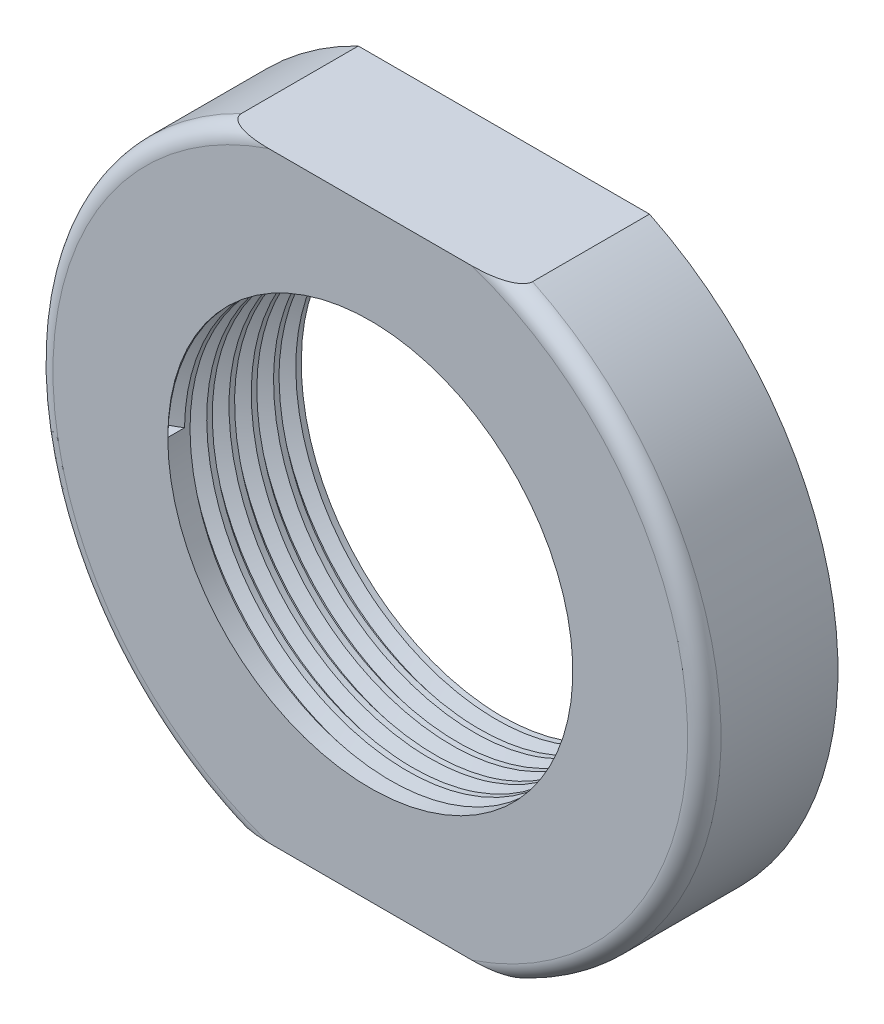
from build123d import *

# Parameters (mm, degrees)
BOSS_EXTRUDE1_DEPTH = 12.7
SKETCH5_R           = 19.2484375
CUT_EXTRUDE1_DEPTH  = 45.563248591
FILLET1_R           = 1.5875
THREAD1_PITCH       = 2.116666667


with BuildPart() as part:
    # Sketch2 → Boss-Extrude1 (new body)
    with BuildSketch(Plane.XY):
        with BuildLine():
            Line((-13.839504146, 28.575), (13.839504146, 28.575))
            ThreePointArc((13.839504146, 28.575), (31.75, 0), (13.839504146, -28.575))
            Line((13.839504146, -28.575), (-13.839504146, -28.575))
            ThreePointArc((-13.839504146, -28.575), (-31.75, 0), (-13.839504146, 28.575))
        make_face()
    extrude(amount=-BOSS_EXTRUDE1_DEPTH)

    # Sketch5 → Cut-Extrude1 (cut, through all)
    with BuildSketch(Plane.XY):
        Circle(SKETCH5_R)
    extrude(amount=-CUT_EXTRUDE1_DEPTH, mode=Mode.SUBTRACT)

    # Fillet1
    fillet1_edges = [part.edges().sort_by_distance(p)[0] for p in [
        (31.75, 0, 0),
        (-31.75, 0, 0),
    ]]
    fillet(fillet1_edges, radius=FILLET1_R)

    # Thread1: the profile of Thread Profile2 profile screwed along a right-hand helix of 18 turns, 10 arcs to a turn; built about Z, then put on its axis
    thread1_z = Axis((0, 0, 0), (0, 0, 1))
    thread1_corners = [(19.2481375, 0, -0.000173205), (20.394116935, 0, 0.66145833), (20.394116935, 0, 0.926041664), (19.2481375, 0, 1.587673199)]
    with BuildLine(mode=Mode.PRIVATE) as thread1_profile:
        Line(thread1_corners[0], thread1_corners[1])
        Line(thread1_corners[1], thread1_corners[2])
        Line(thread1_corners[2], thread1_corners[3])
        Line(thread1_corners[3], thread1_corners[0])
    thread1_cap = Face(thread1_profile.wire())
    thread1_turn_angles = [0, 18, 36, 54, 72, 90, 108, 126, 144, 162, 180, 198, 216, 234, 252, 270, 288, 306, 324, 342, 360]
    thread1_turn_weights = [1, 0.9510565162951535, 1, 0.9510565162951535, 1, 0.9510565162951535, 1, 0.9510565162951535, 1, 0.9510565162951535, 1, 0.9510565162951535, 1, 0.9510565162951535, 1, 0.9510565162951535, 1, 0.9510565162951535, 1, 0.9510565162951535, 1]
    thread1_turn_rails = [Edge.make_bspline([Vector(p[0], p[1], 0).rotate(thread1_z, thread1_turn_angles[k]) / thread1_turn_weights[k] + Vector(0, 0, p[2] + THREAD1_PITCH * thread1_turn_angles[k] / 360) for k in range(21)], [0, 0, 0, 1, 1, 2, 2, 3, 3, 4, 4, 5, 5, 6, 6, 7, 7, 8, 8, 9, 9, 10, 10, 10], 2, thread1_turn_weights) for p in thread1_corners]
    thread1_turn_sides = [Face.make_surface_from_curves(thread1_turn_rails[p[0]], thread1_turn_rails[p[1]]) for p in [(0, 1), (1, 2), (2, 3), (3, 0)]]
    thread1 = Plane(origin=(0, 0, 0), x_dir=(-1, 0, 0), z_dir=(0, 0, -1)) * Solid(Shell([*[p.moved(Location((0, 0, THREAD1_PITCH * i))) for i in range(18) for p in thread1_turn_sides], thread1_cap, thread1_cap.rotate(thread1_z, 6480).moved(Location((0, 0, THREAD1_PITCH * 6480 / 360)))]))
    add(thread1, mode=Mode.SUBTRACT)


solid = part.part
